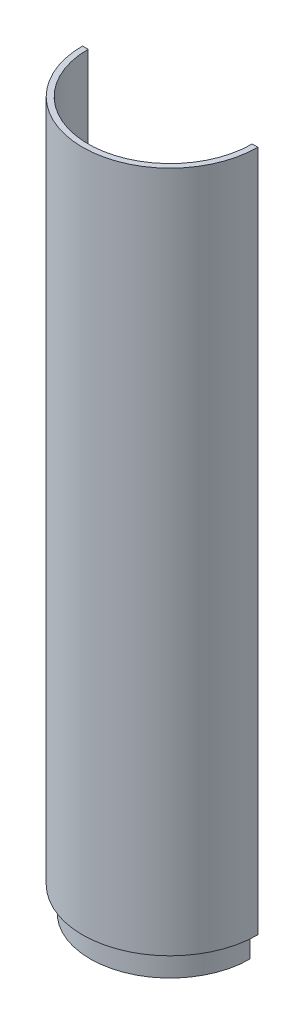
from build123d import *
from build123d.topology import SkipClean

# Parameters (mm, degrees)
BOSS_EXTRUDE1_DEPTH      = 3.81
BOSS_EXTRUDE1_DEPTH_BACK = 6.35
SKETCH1_R                = 49.4538
SKETCH2_R                = 49.4538
BOSS_EXTRUDE2_DEPTH      = 381
SHELL1_T                 = -3.175
CUT_EXTRUDE1_DEPTH       = 398.363186857
BOSS_EXTRUDE3_DEPTH      = 3.81
SKETCH7_R                = 49.4538
SKETCH7_R_2              = 45.085
CUT_EXTRUDE2_DEPTH       = 6.35
BOSS_EXTRUDE4_START      = 7.62
BOSS_EXTRUDE4_DEPTH      = 7.62
SKETCH10_R               = 35.56
CUT_EXTRUDE3_DEPTH       = 6.35
SKETCH11_R               = 8.382
CUT_EXTRUDE4_DEPTH       = 5.08
SKETCH12_R               = 3.302
CUT_EXTRUDE5_DEPTH       = 402.739558289
BOSS_EXTRUDE5_DEPTH      = 5.08
SKETCH14_R               = 4.191
CUT_EXTRUDE6_DEPTH       = 405.866453376


with BuildPart() as part:
    # Sketch1 → Boss-Extrude1 (new, two sides: drawn at the far end of the back side and taken through both)
    with BuildSketch(Plane(origin=(0, 0, 0), x_dir=(1, 0, 0), z_dir=(0, 1, 0)).offset(-BOSS_EXTRUDE1_DEPTH_BACK)):
        Circle(SKETCH1_R)
    extrude(amount=BOSS_EXTRUDE1_DEPTH + BOSS_EXTRUDE1_DEPTH_BACK)

    # Sketch2 → Boss-Extrude2 (add)
    with BuildSketch(Plane(origin=(0, 3.81, 0), x_dir=(1, 0, 0), z_dir=(0, 1, 0))):
        Circle(SKETCH2_R)
    extrude(amount=BOSS_EXTRUDE2_DEPTH)

    # Shell1
    shell1_openings = [part.faces().sort_by_distance(p)[0] for p in [
        (0, 384.81, 0),
    ]]
    offset(amount=SHELL1_T, openings=shell1_openings, kind=Kind.INTERSECTION)

    # Sketch4 → Cut-Extrude1 (cut, through all)
    with BuildSketch(Plane.XZ.offset(6.35)):
        with BuildLine():
            Line((49.4538, 0), (12.7, 0))
            ThreePointArc((12.7, 0), (0, -12.7), (-12.7, 0))
            Line((-12.7, 0), (-49.4538, 0))
            ThreePointArc((-49.4538, 0), (0, -49.4538), (49.4538, 0))
        make_face()
    extrude(amount=-CUT_EXTRUDE1_DEPTH, mode=Mode.SUBTRACT)

    # Sketch5 → Boss-Extrude3 (add)
    with BuildSketch(Plane(origin=(0, -3.175, 0), x_dir=(1, 0, 0), z_dir=(0, 1, 0))):
        with BuildLine():
            Line((-46.2788, 0), (-12.7, 0))
            ThreePointArc((-12.7, 0), (0, 12.7), (12.7, 0))
            Line((12.7, 0), (46.2788, 0))
            ThreePointArc((46.2788, 0), (0, -46.2788), (-46.2788, 0))
        make_face()
    extrude(amount=BOSS_EXTRUDE3_DEPTH)

    # Sketch7 → Cut-Extrude2 (cut)
    with BuildSketch(Plane.XZ.offset(6.35)):
        Circle(SKETCH7_R)
        Circle(SKETCH7_R_2, mode=Mode.SUBTRACT)
    extrude(amount=-CUT_EXTRUDE2_DEPTH, mode=Mode.SUBTRACT)

    # Sketch9 → Boss-Extrude4 (add)
    with SkipClean():  # the faces are left unmerged after this step: merging them gives an invalid solid
        with BuildSketch(Plane.XZ.offset(6.35).offset(BOSS_EXTRUDE4_START)):
            with BuildLine():
                Line((45.085, 0), (12.7, 0))
                ThreePointArc((12.7, 0), (0, -12.7), (-12.7, 0))
                Line((-12.7, 0), (-45.085, 0))
                ThreePointArc((-45.085, 0), (0, 45.085), (45.085, 0))
            make_face()
        extrude(amount=-BOSS_EXTRUDE4_DEPTH)
    add(part.part.scale(1), mode=Mode.REPLACE)  # the faces are merged on a copy

    # Sketch10 → Cut-Extrude3 (cut)
    with BuildSketch(Plane(origin=(0, 0.635, 0), x_dir=(1, 0, 0), z_dir=(0, 1, 0))):
        Circle(SKETCH10_R)
    extrude(amount=-CUT_EXTRUDE3_DEPTH, mode=Mode.SUBTRACT)

    # Sketch11 → Cut-Extrude4 (cut)
    with BuildSketch(Plane(origin=(0, -5.715, 0), x_dir=(1, 0, 0), z_dir=(0, 1, 0))):
        Circle(SKETCH11_R)
    extrude(amount=-CUT_EXTRUDE4_DEPTH, mode=Mode.SUBTRACT)

    # Sketch12 → Cut-Extrude5 (cut, through all)
    with BuildSketch(Plane(origin=(0, -10.795, 0), x_dir=(1, 0, 0), z_dir=(0, 1, 0))):
        Circle(SKETCH12_R)
    extrude(amount=-CUT_EXTRUDE5_DEPTH, mode=Mode.SUBTRACT)

    # Sketch13 → Boss-Extrude5 (add)
    with SkipClean():  # the faces are left unmerged after this step: merging them gives an invalid solid
        with BuildSketch(Plane(origin=(0, 0.635, 0), x_dir=(1, 0, 0), z_dir=(0, 1, 0))):
            with BuildLine():
                Line((-46.2788, 0), (-35.56, 0))
                ThreePointArc((-35.56, 0), (0, -35.56), (35.56, 0))
                Line((35.56, 0), (46.2788, 0))
                ThreePointArc((46.2788, 0), (0, -46.2788), (-46.2788, 0))
            make_face()
        extrude(amount=BOSS_EXTRUDE5_DEPTH)
    add(part.part.scale(1), mode=Mode.REPLACE)  # the faces are merged on a copy

    # Sketch14 → Cut-Extrude6 (cut, through all)
    with BuildSketch(Plane.XZ.offset(13.97)):
        with Locations((0, 15.24)):
            Circle(SKETCH14_R)
    extrude(amount=-CUT_EXTRUDE6_DEPTH, mode=Mode.SUBTRACT)


solid = part.part
